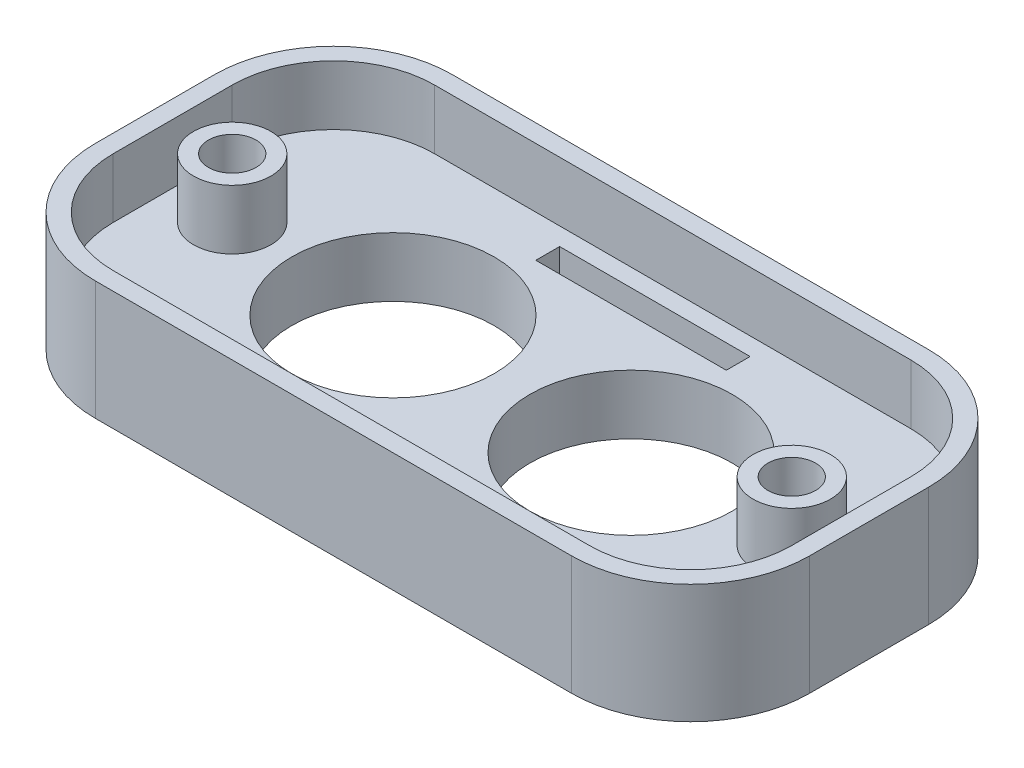
from build123d import *

# Parameters (mm, degrees)
SKETCH_1_R          = 8.5
EXTRUDE_1_DEPTH     = 10
CUT_EXTRUDE_START   = -5
SKETCH_2_R          = 8.5
CUT_EXTRUDE_1_DEPTH = 5
SKETCH_3_R          = 3.25
SKETCH_3_R_2        = 2
EXTRUDE_2_DEPTH     = 5
SKETCH_4_W          = 16
SKETCH_4_H          = 2
CUT_EXTRUDE_2_DEPTH = 34.911649916


with BuildPart() as part:
    # Эскиз1 → Бобышка-Вытянуть1 (new body)
    with BuildSketch(Plane(origin=(0, 0, 0), x_dir=(1, 0, 0), z_dir=(0, 1, 0))):
        with BuildLine():
            Line((-20, 15), (20, 15))
            ThreePointArc((20, 15), (27.071067812, 12.071067812), (30, 5))
            Line((30, 5), (30, -5))
            ThreePointArc((30, -5), (27.071067812, -12.071067812), (20, -15))
            Line((20, -15), (-20, -15))
            ThreePointArc((-20, -15), (-27.071067812, -12.071067812), (-30, -5))
            Line((-30, -5), (-30, 5))
            ThreePointArc((-30, 5), (-27.071067812, 12.071067812), (-20, 15))
        make_face()
        with Locations((-10, 0)):
            Circle(SKETCH_1_R, mode=Mode.SUBTRACT)
        with Locations((10, 0)):
            Circle(SKETCH_1_R, mode=Mode.SUBTRACT)
    extrude(amount=EXTRUDE_1_DEPTH)

    # Эскиз2 → Вырез-Вытянуть1 (cut)
    with BuildSketch(Plane(origin=(0, 10, 0), x_dir=(1, 0, 0), z_dir=(0, 1, 0)).offset(CUT_EXTRUDE_START)):
        with BuildLine():
            ThreePointArc((-20, 13.5), (-26.01040764, 11.01040764), (-28.5, 5))
            Line((-28.5, 5), (-28.5, -5))
            ThreePointArc((-28.5, -5), (-26.01040764, -11.01040764), (-20, -13.5))
            Line((-20, -13.5), (20, -13.5))
            ThreePointArc((20, -13.5), (26.01040764, -11.01040764), (28.5, -5))
            Line((28.5, -5), (28.5, 5))
            ThreePointArc((28.5, 5), (26.01040764, 11.01040764), (20, 13.5))
            Line((20, 13.5), (-20, 13.5))
        make_face()
        with Locations((-10, 0)):
            Circle(SKETCH_2_R, mode=Mode.SUBTRACT)
        with Locations((10, 0)):
            Circle(SKETCH_2_R, mode=Mode.SUBTRACT)
    extrude(amount=CUT_EXTRUDE_1_DEPTH, mode=Mode.SUBTRACT)

    # Эскиз3 → Бобышка-Вытянуть2 (add)
    # profile 1 of 2: a face of its own
    with BuildSketch(Plane(origin=(0, 5, 0), x_dir=(1, 0, 0), z_dir=(0, 1, 0))):
        with Locations((-23.5, 0)):
            Circle(SKETCH_3_R)
        with Locations((-23.5, 0)):
            Circle(SKETCH_3_R_2, mode=Mode.SUBTRACT)
    # profile 2 of 2: a face of its own
    with BuildSketch(Plane(origin=(0, 5, 0), x_dir=(1, 0, 0), z_dir=(0, 1, 0))):
        with Locations((23.5, 0)):
            Circle(SKETCH_3_R)
        with Locations((23.5, 0)):
            Circle(SKETCH_3_R_2, mode=Mode.SUBTRACT)
    extrude(amount=EXTRUDE_2_DEPTH)

    # Эскиз4 → Вырез-Вытянуть2 (cut, through all)
    with BuildSketch(Plane(origin=(0, 5, 0), x_dir=(1, 0, 0), z_dir=(0, 1, 0))):
        with Locations((0, 11)):
            Rectangle(SKETCH_4_W, SKETCH_4_H)
        with Locations((0, -11)):
            Rectangle(SKETCH_4_W, SKETCH_4_H)
    extrude(amount=-CUT_EXTRUDE_2_DEPTH, mode=Mode.SUBTRACT)


solid = part.part
